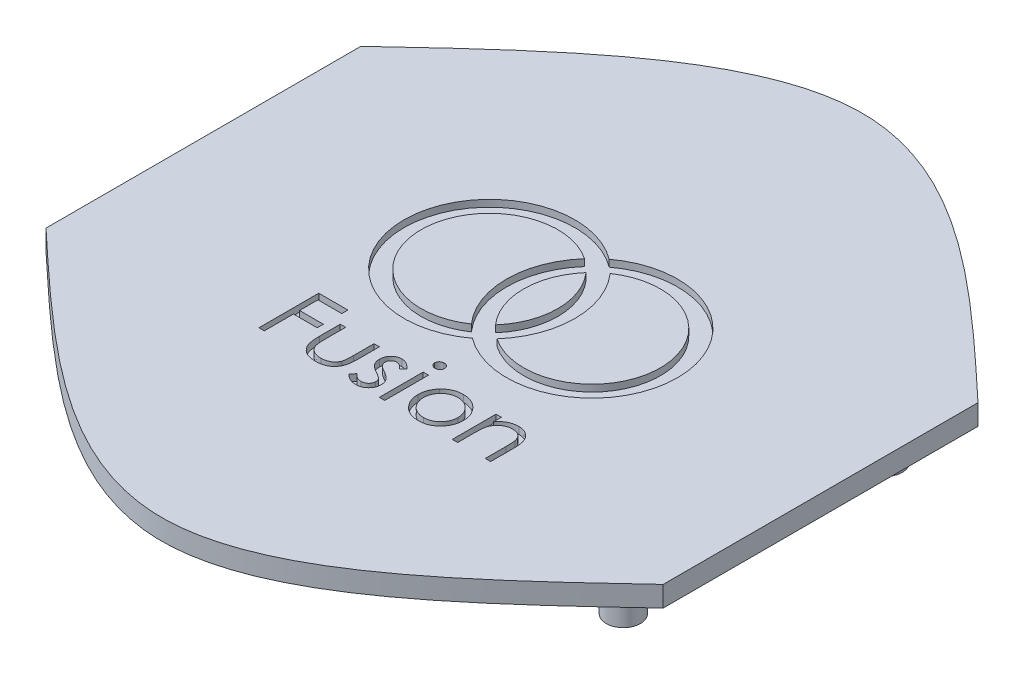
from build123d import *

# Parameters (mm, degrees)
BOSS_EXTRUDE1_DEPTH = 1.2
SKETCH3_R           = 1
BOSS_EXTRUDE2_DEPTH = 3
CUT_EXTRUDE1_DEPTH  = 0.4
SKETCH6_W           = 0.314102564
SKETCH6_H           = 2.557692308
CUT_EXTRUDE2_DEPTH  = 0.4


with BuildPart() as part:
    # Sketch1 → Boss-Extrude1 (new body)
    with BuildSketch(Plane(origin=(0, 0, 0), x_dir=(1, 0, 0), z_dir=(0, 1, 0))):
        with BuildLine():
            Line((0, 41.863275017), (0, 60.273275017))
            add(Edge.make_bspline(
                [(-36.089994589, 60.273275017), (-30.074992276, 65.911788101), (-18.044987203, 77.188479216), (-6.014995884, 65.911788385), (0, 60.273275017)],
                knots=[0, 0, 0, 0, 0.499999981, 1, 1, 1, 1], degree=3))
            Line((-36.089994589, 60.273275017), (-36.089994589, 41.863275017))
            add(Edge.make_bspline(
                [(-36.089994589, 41.863275017), (-30.074992276, 36.224761933), (-18.044987203, 24.948070818), (-6.014995884, 36.22476165), (0, 41.863275017)],
                knots=[0, 0, 0, 0, 0.499999981, 1, 1, 1, 1], degree=3))
        make_face()
    extrude(amount=BOSS_EXTRUDE1_DEPTH)

    # Sketch3 → Boss-Extrude2 (add)
    with BuildSketch(Plane.XZ):
        with Locations((-32.210609347, -58.722469159)):
            Circle(SKETCH3_R)
        with Locations((-32.210609347, -43.414080875)):
            Circle(SKETCH3_R)
        with Locations((-3.879385242, -43.414080875)):
            Circle(SKETCH3_R)
        with Locations((-3.879385242, -58.722469159)):
            Circle(SKETCH3_R)
    extrude(amount=BOSS_EXTRUDE2_DEPTH)

    # Sketch5 → Cut-Extrude1 (cut)
    with BuildSketch(Plane(origin=(0, 1.2, 0), x_dir=(1, 0, 0), z_dir=(0, 1, 0))):
        with BuildLine():
            ThreePointArc((-18.044997294, 56.751086287), (-26.044997294, 52.751086287), (-18.044997294, 48.751086287))
            ThreePointArc((-18.044997294, 48.751086287), (-10.044997294, 52.751086287), (-18.044997294, 56.751086287))
        make_face()
        with BuildLine():
            ThreePointArc((-18.044997294, 55.396837598), (-17.044997294, 52.751086287), (-18.044997294, 50.105334976))
            ThreePointArc((-18.044997294, 50.105334976), (-19.044997294, 52.751086287), (-18.044997294, 55.396837598))
        make_face(mode=Mode.SUBTRACT)
        with BuildLine():
            ThreePointArc((-17.294997294, 56.058275426), (-11.044997294, 52.751086287), (-17.294997294, 49.443897149))
            ThreePointArc((-17.294997294, 49.443897149), (-16.044997294, 52.751086287), (-17.294997294, 56.058275426))
        make_face(mode=Mode.SUBTRACT)
        with BuildLine():
            ThreePointArc((-18.794997294, 56.058275426), (-20.044997294, 52.751086287), (-18.794997294, 49.443897149))
            ThreePointArc((-18.794997294, 49.443897149), (-25.044997294, 52.751086287), (-18.794997294, 56.058275426))
        make_face(mode=Mode.SUBTRACT)
    extrude(amount=-CUT_EXTRUDE1_DEPTH, mode=Mode.SUBTRACT)

    # Sketch6 → Cut-Extrude2 (cut)
    # profile 1 of 7: a face of its own
    with BuildSketch(Plane(origin=(0, 1.2, 0), x_dir=(1, 0, 0), z_dir=(0, 1, 0))):
        Polygon((-24.817053319, 46.540134371), (-23.111925113, 46.540134371), (-23.111925113, 46.181160012), (-24.502950754, 46.181160012), (-24.502950754, 45.104236935), (-23.111925113, 45.104236935), (-23.111925113, 44.745262576), (-24.502950754, 44.745262576), (-24.502950754, 43.040134371), (-24.817053319, 43.040134371), align=None)
    # profile 2 of 7: a face of its own
    with BuildSketch(Plane(origin=(0, 1.2, 0), x_dir=(1, 0, 0), z_dir=(0, 1, 0))):
        with BuildLine():
            Line((-22.61833537, 45.597826679), (-22.304232806, 45.597826679))
            Line((-22.304232806, 45.597826679), (-22.304232806, 44.411528602))
            add(Edge.make_bspline(
                [(-22.304232806, 44.411528602), (-22.304090901, 44.376705853), (-22.303819443, 44.310091565), (-22.301978502, 44.214236378), (-22.297648409, 44.126819665), (-22.292234584, 44.047790928), (-22.285272448, 43.977163537), (-22.276989088, 43.91518418), (-22.267730666, 43.861149996), (-22.258667952, 43.82860664), (-22.254453158, 43.813471711)],
                knots=[0, 0, 0, 0, 1.388932606, 2.656963016, 3.823490214, 4.879454478, 5.816252168, 6.653371382, 7.373723809, 8, 8, 8, 8], degree=3))
            add(Edge.make_bspline(
                [(-22.254453158, 43.813471711), (-22.247691703, 43.79444884), (-22.234309362, 43.756798579), (-22.210035878, 43.702409574), (-22.180007542, 43.652034291), (-22.147147714, 43.603730218), (-22.109248306, 43.558928232), (-22.066788835, 43.517703988), (-22.021190598, 43.478499897), (-21.953435575, 43.432115105), (-21.860776309, 43.382399775), (-21.739123554, 43.339503956), (-21.607219328, 43.313868136), (-21.516054608, 43.310893881), (-21.469196748, 43.30936514)],
                knots=[0, 0, 0, 0, 0.725840625, 1.436591201, 2.137033971, 2.831655856, 3.53531722, 4.242432219, 4.957935707, 5.694543706, 7.190802206, 8.724350549, 10.316345118, 12, 12, 12, 12], degree=3))
            add(Edge.make_bspline(
                [(-21.469196748, 43.30936514), (-21.42234324, 43.310926389), (-21.331690372, 43.313947116), (-21.201235403, 43.338730655), (-21.081983988, 43.380136344), (-20.975133037, 43.437943755), (-20.881167197, 43.508685818), (-20.802862778, 43.591694627), (-20.738255523, 43.684344014), (-20.710046103, 43.753468293), (-20.695859408, 43.788231326)],
                knots=[0, 0, 0, 0, 1.157059328, 2.238695713, 3.266970494, 4.264342957, 5.228770407, 6.160125903, 7.074715775, 8, 8, 8, 8], degree=3))
            add(Edge.make_bspline(
                [(-20.695859408, 43.788231326), (-20.691665178, 43.802197625), (-20.68239276, 43.8330737), (-20.672430408, 43.885453449), (-20.663455947, 43.947918053), (-20.655792771, 44.020876262), (-20.650327608, 44.104137414), (-20.647381581, 44.19767549), (-20.644053306, 44.301196851), (-20.64400279, 44.37366461), (-20.643976395, 44.411528602)],
                knots=[0, 0, 0, 0, 0.557542046, 1.232589297, 2.036731608, 2.971723315, 4.038036528, 5.22795436, 6.551621927, 8, 8, 8, 8], degree=3))
            Line((-20.643976395, 44.411528602), (-20.643976395, 45.597826679))
            Line((-20.643976395, 45.597826679), (-20.329873831, 45.597826679))
            Line((-20.329873831, 45.597826679), (-20.329873831, 44.352634371))
            add(Edge.make_bspline(
                [(-20.329873831, 44.352634371), (-20.330315526, 44.3103272), (-20.331172475, 44.2282455), (-20.336679818, 44.108961388), (-20.346129431, 43.997799143), (-20.360472116, 43.894699923), (-20.37733779, 43.799742442), (-20.399094063, 43.712804996), (-20.425072301, 43.634155442), (-20.454377816, 43.562413665), (-20.488999683, 43.497366771), (-20.525826704, 43.435630954), (-20.568351476, 43.378738019), (-20.61312171, 43.323855882), (-20.662923366, 43.273714354), (-20.716823225, 43.227162878), (-20.774062645, 43.183489847), (-20.835911843, 43.144398567), (-20.901467906, 43.109181922), (-20.970811763, 43.077965844), (-21.044792761, 43.053263267), (-21.122456398, 43.031952601), (-21.204183177, 43.015238132), (-21.28989431, 43.003451565), (-21.379560927, 42.996226234), (-21.440670386, 42.995589189), (-21.472001235, 42.995262576)],
                knots=[0, 0, 0, 0, 1.493040784, 2.896703357, 4.213163133, 5.428574705, 6.569057535, 7.615249723, 8.588095153, 9.490268104, 10.346124644, 11.18633936, 12.024365274, 12.850166724, 13.684164916, 14.514361689, 15.362232829, 16.222528818, 17.093394965, 17.986930858, 18.902426812, 19.842810585, 20.827885679, 21.843828298, 22.894529745, 24, 24, 24, 24], degree=3))
            add(Edge.make_bspline(
                [(-21.472001235, 42.995262576), (-21.503097749, 42.995602283), (-21.564205294, 42.99626984), (-21.653876539, 43.003411647), (-21.739825145, 43.015219818), (-21.821745543, 43.032075035), (-21.899719941, 43.053114105), (-21.974064181, 43.078117641), (-22.043907744, 43.109198122), (-22.110089748, 43.14417568), (-22.172092136, 43.183740955), (-22.230200714, 43.227108995), (-22.284337566, 43.274215058), (-22.334514634, 43.324862415), (-22.380027611, 43.379679351), (-22.421443653, 43.438224912), (-22.459400358, 43.499919), (-22.493753148, 43.565982163), (-22.523264904, 43.638554173), (-22.54932015, 43.71885127), (-22.570630788, 43.807753787), (-22.587973256, 43.905185715), (-22.601924697, 44.010680757), (-22.611610839, 44.124849172), (-22.61702667, 44.247412864), (-22.617889731, 44.332062754), (-22.61833537, 44.37577139)],
                knots=[0, 0, 0, 0, 1.083640291, 2.129454052, 3.13281866, 4.105697902, 5.042300162, 5.946461698, 6.836384745, 7.703652036, 8.553297018, 9.397182691, 10.228592656, 11.052265423, 11.879314572, 12.708807002, 13.549817954, 14.402308542, 15.300838682, 16.27712199, 17.341985831, 18.484375296, 19.725102775, 21.0496083, 22.476576903, 24, 24, 24, 24], degree=3))
            Line((-22.61833537, 44.37577139), (-22.61833537, 45.597826679))
        make_face()
    # profile 3 of 7: a face of its own
    with BuildSketch(Plane(origin=(0, 1.2, 0), x_dir=(1, 0, 0), z_dir=(0, 1, 0))):
        with BuildLine():
            Line((-18.400386652, 45.278816262), (-18.613527677, 45.05936514))
            add(Edge.make_bspline(
                [(-18.613527677, 45.05936514), (-18.631918181, 45.080678287), (-18.667372907, 45.121767524), (-18.723604388, 45.17670459), (-18.779627991, 45.222841529), (-18.834676805, 45.261793788), (-18.890135074, 45.291242935), (-18.945351992, 45.312737797), (-19.000384731, 45.326039602), (-19.037170766, 45.327754041), (-19.055234408, 45.32859591)],
                knots=[0, 0, 0, 0, 1.26578478, 2.440284043, 3.530471711, 4.527705817, 5.468200915, 6.346673037, 7.188140097, 8, 8, 8, 8], degree=3))
            add(Edge.make_bspline(
                [(-19.055234408, 45.32859591), (-19.077373798, 45.327521037), (-19.120940984, 45.325405839), (-19.183366802, 45.304292408), (-19.241317427, 45.27188367), (-19.291474407, 45.225915086), (-19.333962087, 45.173150817), (-19.364975768, 45.114154493), (-19.383941752, 45.050706449), (-19.386346484, 45.006676591), (-19.387566139, 44.984345108)],
                knots=[0, 0, 0, 0, 0.99966794, 1.967205029, 2.953328237, 3.988086729, 5.028030931, 6.008226631, 6.989793394, 8, 8, 8, 8], degree=3))
            add(Edge.make_bspline(
                [(-19.387566139, 44.984345108), (-19.386455327, 44.964133064), (-19.384236834, 44.923765953), (-19.366990154, 44.864217919), (-19.339524082, 44.806160881), (-19.313853888, 44.770597975), (-19.300627036, 44.752273794)],
                knots=[0, 0, 0, 0, 0.960159726, 1.917612774, 2.927026955, 4, 4, 4, 4], degree=3))
            add(Edge.make_bspline(
                [(-19.300627036, 44.752273794), (-19.292663543, 44.74248921), (-19.27571425, 44.721663955), (-19.243905735, 44.692760102), (-19.207883232, 44.660817851), (-19.164563294, 44.628881014), (-19.115812266, 44.595249289), (-19.060572982, 44.561247156), (-19.000598477, 44.524282731), (-18.957661171, 44.500838295), (-18.935342581, 44.488651999)],
                knots=[0, 0, 0, 0, 0.66740084, 1.420478572, 2.27185888, 3.217733974, 4.268547843, 5.408967954, 6.65319498, 8, 8, 8, 8], degree=3))
            add(Edge.make_bspline(
                [(-18.935342581, 44.488651999), (-18.908129004, 44.473407096), (-18.855561334, 44.443958964), (-18.780868567, 44.398249261), (-18.713081526, 44.352817836), (-18.651625858, 44.308150562), (-18.597684049, 44.262997695), (-18.549619497, 44.219089938), (-18.508631053, 44.17510063), (-18.485677126, 44.144367516), (-18.474705562, 44.12967764)],
                knots=[0, 0, 0, 0, 1.27191281, 2.456916733, 3.569705269, 4.599008579, 5.553216877, 6.436649441, 7.252746552, 8, 8, 8, 8], degree=3))
            add(Edge.make_bspline(
                [(-18.474705562, 44.12967764), (-18.456495035, 44.100011552), (-18.420252705, 44.040970531), (-18.382194439, 43.943752104), (-18.360134164, 43.840641601), (-18.357071944, 43.770109381), (-18.355514857, 43.734244948)],
                knots=[0, 0, 0, 0, 0.995354457, 1.980940102, 2.973342415, 4, 4, 4, 4], degree=3))
            add(Edge.make_bspline(
                [(-18.355514857, 43.734244948), (-18.356234391, 43.708975802), (-18.357652311, 43.659180189), (-18.367510378, 43.585845359), (-18.384465354, 43.515710801), (-18.407559108, 43.448015517), (-18.438743481, 43.384056577), (-18.475291278, 43.322220328), (-18.51916619, 43.263844397), (-18.569257565, 43.209005437), (-18.624103059, 43.15891969), (-18.682609198, 43.114895736), (-18.744848028, 43.078321399), (-18.81037483, 43.048056053), (-18.879338484, 43.023987795), (-18.951749773, 43.007325264), (-19.027378528, 42.997352503), (-19.078808336, 42.995968027), (-19.105014056, 42.995262576)],
                knots=[0, 0, 0, 0, 1.032770009, 2.035186124, 3.017557409, 3.978232242, 4.952395191, 5.920591857, 6.910227898, 7.931268572, 8.952309245, 9.941945286, 10.918353717, 11.897095711, 12.887975737, 13.898235213, 14.929059601, 16, 16, 16, 16], degree=3))
            add(Edge.make_bspline(
                [(-19.105014056, 42.995262576), (-19.140381231, 42.996255277), (-19.210624158, 42.998226884), (-19.314513877, 43.016732945), (-19.416034636, 43.045528339), (-19.514418176, 43.085244273), (-19.60746429, 43.135394986), (-19.692595215, 43.195457379), (-19.770106677, 43.263447377), (-19.814224951, 43.315560288), (-19.836284088, 43.341616743)],
                knots=[0, 0, 0, 0, 1.013940152, 2.01379169, 3.017749504, 4.037548394, 5.051665909, 6.043208538, 7.021604269, 8, 8, 8, 8], degree=3))
            Line((-19.836284088, 43.341616743), (-19.628050915, 43.57859591))
            add(Edge.make_bspline(
                [(-19.628050915, 43.57859591), (-19.608278502, 43.557241145), (-19.569946689, 43.515841705), (-19.508645473, 43.460717364), (-19.446266072, 43.414516093), (-19.383431385, 43.375872678), (-19.319211291, 43.346097275), (-19.253965676, 43.325178681), (-19.187827252, 43.311734489), (-19.143405117, 43.310156207), (-19.121139857, 43.30936514)],
                knots=[0, 0, 0, 0, 1.179806542, 2.287233372, 3.337373186, 4.324005949, 5.273901747, 6.200048787, 7.097828587, 8, 8, 8, 8], degree=3))
            add(Edge.make_bspline(
                [(-19.121139857, 43.30936514), (-19.090821931, 43.310735965), (-19.031585789, 43.313414327), (-18.946742031, 43.337731419), (-18.868403404, 43.375861371), (-18.800380059, 43.429946069), (-18.742477898, 43.492901642), (-18.700549723, 43.563815761), (-18.674273548, 43.640607218), (-18.671187549, 43.69383952), (-18.669617421, 43.720923634)],
                knots=[0, 0, 0, 0, 1.072336372, 2.095165389, 3.102688358, 4.141489647, 5.156069229, 6.117746104, 7.042326257, 8, 8, 8, 8], degree=3))
            add(Edge.make_bspline(
                [(-18.669617421, 43.720923634), (-18.670703715, 43.743233253), (-18.672848458, 43.787280608), (-18.68969173, 43.851030949), (-18.716304582, 43.91150023), (-18.742509231, 43.946889877), (-18.755855402, 43.964914019)],
                knots=[0, 0, 0, 0, 1.013901739, 2.00181326, 2.98231254, 4, 4, 4, 4], degree=3))
            add(Edge.make_bspline(
                [(-18.755855402, 43.964914019), (-18.763877796, 43.973949381), (-18.781353469, 43.993631663), (-18.81340871, 44.022056742), (-18.851790572, 44.052694841), (-18.896930735, 44.08502643), (-18.948920197, 44.118625035), (-19.007969672, 44.153314387), (-19.073270225, 44.190742113), (-19.119440856, 44.215561768), (-19.143575754, 44.228535813)],
                knots=[0, 0, 0, 0, 0.615000592, 1.339693406, 2.178160186, 3.116406724, 4.166410947, 5.330106347, 6.604359322, 8, 8, 8, 8], degree=3))
            add(Edge.make_bspline(
                [(-19.143575754, 44.228535813), (-19.169622394, 44.243074945), (-19.220135142, 44.271270961), (-19.291682433, 44.315187042), (-19.356229787, 44.359854316), (-19.415330362, 44.402767156), (-19.467491367, 44.446188099), (-19.512507316, 44.490165351), (-19.552150531, 44.532925337), (-19.574097943, 44.563222634), (-19.584581363, 44.577694467)],
                knots=[0, 0, 0, 0, 1.262093308, 2.447601706, 3.550203992, 4.582594899, 5.537233252, 6.418365656, 7.244515135, 8, 8, 8, 8], degree=3))
            add(Edge.make_bspline(
                [(-19.584581363, 44.577694467), (-19.602711963, 44.606840082), (-19.638979498, 44.665141498), (-19.674194689, 44.762451974), (-19.698400718, 44.864897032), (-19.700563108, 44.935583886), (-19.701668703, 44.971724916)],
                knots=[0, 0, 0, 0, 0.985009483, 1.970363186, 2.962279964, 4, 4, 4, 4], degree=3))
            add(Edge.make_bspline(
                [(-19.701668703, 44.971724916), (-19.701134508, 44.995350314), (-19.700089012, 45.041588565), (-19.69174496, 45.109527385), (-19.676553249, 45.174075539), (-19.657498326, 45.236202402), (-19.631015322, 45.294704496), (-19.599369417, 45.350361967), (-19.562181992, 45.403097885), (-19.519338701, 45.452101017), (-19.472232056, 45.496610343), (-19.421337286, 45.535408971), (-19.36779903, 45.568515326), (-19.31139061, 45.596280487), (-19.251570137, 45.617281869), (-19.188755751, 45.631739255), (-19.123074596, 45.641394457), (-19.07817347, 45.642257542), (-19.055234408, 45.642698474)],
                knots=[0, 0, 0, 0, 1.087655834, 2.128696564, 3.144119009, 4.137814668, 5.115653402, 6.093965665, 7.082169637, 8.081268856, 9.086088321, 10.061021666, 11.022561449, 11.980240094, 12.950172527, 13.934149372, 14.944599409, 16, 16, 16, 16], degree=3))
            add(Edge.make_bspline(
                [(-19.055234408, 45.642698474), (-19.028042345, 45.641594133), (-18.973148123, 45.639364735), (-18.890793497, 45.621659045), (-18.808560155, 45.592525941), (-18.726236805, 45.552289707), (-18.644426515, 45.500222831), (-18.562409659, 45.437293532), (-18.479201629, 45.363915817), (-18.427245315, 45.307816592), (-18.400386652, 45.278816262)],
                knots=[0, 0, 0, 0, 0.845714091, 1.707292901, 2.609013841, 3.555613372, 4.552488639, 5.621697636, 6.770543573, 8, 8, 8, 8], degree=3))
        make_face()
    # profile 4 of 7: a face of its own
    with BuildSketch(Plane(origin=(0, 1.2, 0), x_dir=(1, 0, 0), z_dir=(0, 1, 0))):
        with BuildLine():
            add(Edge.make_bspline(
                [(-17.616532485, 46.674749756), (-17.597041169, 46.673845603), (-17.55887343, 46.672075099), (-17.503680162, 46.656913622), (-17.45342315, 46.631213937), (-17.408845417, 46.596734256), (-17.37059353, 46.556184812), (-17.34381282, 46.508923844), (-17.326600424, 46.457865205), (-17.324521868, 46.422250116), (-17.323463575, 46.404116743)],
                knots=[0, 0, 0, 0, 1.055194115, 2.066272739, 3.074728998, 4.095836921, 5.109056067, 6.073838105, 7.019297344, 8, 8, 8, 8], degree=3))
            add(Edge.make_bspline(
                [(-17.323463575, 46.404116743), (-17.324545735, 46.38645409), (-17.326685037, 46.351537115), (-17.343799525, 46.301363643), (-17.370821763, 46.254759359), (-17.408820888, 46.214288649), (-17.453429649, 46.179828029), (-17.503678435, 46.15412329), (-17.558873884, 46.138963153), (-17.597041323, 46.137192464), (-17.616532485, 46.136288217)],
                knots=[0, 0, 0, 0, 0.96129708, 1.900370562, 2.859976407, 3.87933698, 4.906634145, 5.921202961, 6.938410037, 8, 8, 8, 8], degree=3))
            add(Edge.make_bspline(
                [(-17.616532485, 46.136288217), (-17.63580076, 46.137157937), (-17.67330394, 46.138850734), (-17.727670783, 46.154420752), (-17.777499272, 46.179836825), (-17.822163945, 46.21406301), (-17.859394138, 46.255007907), (-17.886492463, 46.301335201), (-17.903567425, 46.351544356), (-17.905712054, 46.386456522), (-17.906796908, 46.404116743)],
                knots=[0, 0, 0, 0, 1.054934014, 2.053291228, 3.073705704, 4.106921865, 5.123545215, 6.088680038, 7.033164197, 8, 8, 8, 8], degree=3))
            add(Edge.make_bspline(
                [(-17.906796908, 46.404116743), (-17.905735822, 46.422247592), (-17.903651781, 46.457857725), (-17.886479664, 46.508952758), (-17.859619857, 46.55593426), (-17.822139293, 46.596959759), (-17.777505833, 46.631205194), (-17.727669088, 46.656616175), (-17.673304388, 46.672187515), (-17.635800912, 46.673880129), (-17.616532485, 46.674749756)],
                knots=[0, 0, 0, 0, 0.98631895, 1.937192651, 2.907499808, 3.917963147, 4.944918757, 5.95915025, 6.951458133, 8, 8, 8, 8], degree=3))
        make_face()
    # profile 5 of 7: a face of its own
    with BuildSketch(Plane(origin=(0, 1.2, 0), x_dir=(1, 0, 0), z_dir=(0, 1, 0))):
        with Locations((-17.615130242, 44.318980525)):
            Rectangle(SKETCH6_W, SKETCH6_H)
    # profile 6 of 7: a face of its own
    with BuildSketch(Plane(origin=(0, 1.2, 0), x_dir=(1, 0, 0), z_dir=(0, 1, 0))):
        with BuildLine():
            add(Edge.make_bspline(
                [(-15.459881844, 45.642698474), (-15.411890571, 45.641676582), (-15.317791414, 45.639672904), (-15.179983528, 45.618257938), (-15.048438392, 45.585510574), (-14.9226522, 45.540239012), (-14.804235904, 45.479557061), (-14.69146466, 45.40714777), (-14.584647651, 45.321365176), (-14.520624622, 45.255007108), (-14.488127036, 45.221324275)],
                knots=[0, 0, 0, 0, 1.054011418, 2.066658804, 3.057071809, 4.030435133, 4.997543892, 5.974964718, 6.972108034, 8, 8, 8, 8], degree=3))
            add(Edge.make_bspline(
                [(-14.488127036, 45.221324275), (-14.460145082, 45.189110289), (-14.404722702, 45.125305747), (-14.333656983, 45.021850134), (-14.272435423, 44.914710033), (-14.223372462, 44.802462707), (-14.184687439, 44.686088036), (-14.157221742, 44.565186024), (-14.140884807, 44.440023677), (-14.13868184, 44.355019839), (-14.137566139, 44.311969307)],
                knots=[0, 0, 0, 0, 1.025258237, 2.030674902, 3.01204498, 3.988269485, 4.97094183, 5.956517959, 6.965070386, 8, 8, 8, 8], degree=3))
            add(Edge.make_bspline(
                [(-14.137566139, 44.311969307), (-14.138547476, 44.268669249), (-14.140486645, 44.183106316), (-14.158830261, 44.05708695), (-14.187361347, 43.934892127), (-14.228193185, 43.817033434), (-14.280551294, 43.703150606), (-14.344441982, 43.593741057), (-14.420313599, 43.488588924), (-14.506317596, 43.388587086), (-14.601369472, 43.296420871), (-14.70448562, 43.216092601), (-14.813639654, 43.147271077), (-14.930283007, 43.091834661), (-15.053350494, 43.048124961), (-15.183107562, 43.017424944), (-15.319352633, 42.998863261), (-15.412379854, 42.996479687), (-15.459881844, 42.995262576)],
                knots=[0, 0, 0, 0, 0.998656419, 1.973391657, 2.932242238, 3.890759089, 4.846373663, 5.82037756, 6.809684879, 7.83454468, 8.860553229, 9.859544525, 10.845671541, 11.83227036, 12.833544569, 13.85385346, 14.904124723, 16, 16, 16, 16], degree=3))
            add(Edge.make_bspline(
                [(-15.459881844, 42.995262576), (-15.507616564, 42.996483772), (-15.601107423, 42.998875547), (-15.737833405, 43.01735283), (-15.867823024, 43.048110812), (-15.991051623, 43.091978305), (-16.10819647, 43.147272849), (-16.217982967, 43.215884538), (-16.321182882, 43.296444693), (-16.416254867, 43.388580631), (-16.502253472, 43.488590587), (-16.57812648, 43.593740625), (-16.642016806, 43.703150719), (-16.69437501, 43.817033404), (-16.735206823, 43.934892136), (-16.763737916, 44.057086948), (-16.78208153, 44.183106317), (-16.784020699, 44.268669249), (-16.785002036, 44.311969307)],
                knots=[0, 0, 0, 0, 1.099876186, 2.154163076, 3.173186993, 4.173200201, 5.163417411, 6.152872554, 7.150605724, 8.17532212, 9.198891216, 10.186952605, 11.159729845, 12.11414092, 13.071450619, 14.029093627, 15.002601286, 16, 16, 16, 16], degree=3))
            add(Edge.make_bspline(
                [(-16.785002036, 44.311969307), (-16.783878726, 44.354785853), (-16.781654765, 44.439555255), (-16.765334256, 44.564482316), (-16.737975699, 44.685179705), (-16.699244303, 44.801105181), (-16.649729112, 44.912860617), (-16.589367824, 45.020265448), (-16.517577191, 45.123253248), (-16.46237524, 45.186975329), (-16.434441139, 45.21922091)],
                knots=[0, 0, 0, 0, 1.031353054, 2.041901799, 3.029428768, 4.008703097, 4.981709435, 5.96992636, 6.972712378, 8, 8, 8, 8], degree=3))
            add(Edge.make_bspline(
                [(-16.434441139, 45.21922091), (-16.401992548, 45.253195849), (-16.338176684, 45.320013545), (-16.230827956, 45.405546069), (-16.118334135, 45.479462143), (-15.998609209, 45.538938358), (-15.872926351, 45.585776876), (-15.740707109, 45.618342391), (-15.602431593, 45.639595746), (-15.507871972, 45.641653924), (-15.459881844, 45.642698474)],
                knots=[0, 0, 0, 0, 1.027980169, 2.021703884, 2.998553061, 3.971491411, 4.943284454, 5.930300938, 6.949603206, 8, 8, 8, 8], degree=3))
        make_face()
        with BuildLine():
            add(Edge.make_bspline(
                [(-15.461284088, 45.32859591), (-15.495221699, 45.327631318), (-15.562220828, 45.325727035), (-15.660840412, 45.311243131), (-15.755780566, 45.288295627), (-15.84722141, 45.25569157), (-15.934854583, 45.213592671), (-16.018763985, 45.161884311), (-16.099196425, 45.101251355), (-16.174578489, 45.031788683), (-16.243760801, 44.955909689), (-16.304238777, 44.87506133), (-16.355663884, 44.790554983), (-16.398504043, 44.702302772), (-16.430411231, 44.609410358), (-16.453584253, 44.512929727), (-16.468054494, 44.412664311), (-16.469940872, 44.344503292), (-16.470899472, 44.309865942)],
                knots=[0, 0, 0, 0, 1.021534396, 2.016698045, 2.994645724, 3.958388632, 4.93408049, 5.916473867, 6.921342795, 7.962252576, 8.998418191, 10.008913653, 10.997312074, 11.973003931, 12.956656626, 13.948281152, 14.957379055, 16, 16, 16, 16], degree=3))
            add(Edge.make_bspline(
                [(-16.470899472, 44.309865942), (-16.469292649, 44.265113914), (-16.466103404, 44.176289509), (-16.440168168, 44.045478386), (-16.396781888, 43.919896534), (-16.338194608, 43.800280148), (-16.26478839, 43.68960787), (-16.178301323, 43.590936386), (-16.079661623, 43.505750574), (-15.970045122, 43.435069729), (-15.851690804, 43.378909973), (-15.726434483, 43.339110997), (-15.595793789, 43.313239305), (-15.506513058, 43.310667831), (-15.461284088, 43.30936514)],
                knots=[0, 0, 0, 0, 1.016792936, 2.018143844, 3.017858371, 4.030088057, 5.03801393, 6.028138512, 7.003788237, 7.991172063, 8.984598303, 9.972568034, 10.972917682, 12, 12, 12, 12], degree=3))
            add(Edge.make_bspline(
                [(-15.461284088, 43.30936514), (-15.416057719, 43.310675421), (-15.326782123, 43.313261877), (-15.196322946, 43.338980697), (-15.071408974, 43.379084358), (-14.953177587, 43.435006568), (-14.843610983, 43.506018982), (-14.744261862, 43.59045536), (-14.658513251, 43.689869211), (-14.585179646, 43.80042674), (-14.525632903, 43.919711092), (-14.482449701, 44.045501564), (-14.456452115, 44.176283606), (-14.453271287, 44.265111937), (-14.451668703, 44.309865942)],
                knots=[0, 0, 0, 0, 1.02726834, 2.027799167, 3.010890988, 4.004497153, 4.992059811, 5.971914811, 6.958719428, 7.966827853, 8.981595046, 9.981490638, 10.983022906, 12, 12, 12, 12], degree=3))
            add(Edge.make_bspline(
                [(-14.451668703, 44.309865942), (-14.452626973, 44.344503499), (-14.454512702, 44.412664925), (-14.468987667, 44.512927379), (-14.492143206, 44.609418975), (-14.524114824, 44.702270978), (-14.566768837, 44.790783483), (-14.61918563, 44.87481321), (-14.679416656, 44.956189756), (-14.749433777, 45.031543397), (-14.824737155, 45.101278433), (-14.905202193, 45.161907823), (-14.988987171, 45.213365418), (-15.076365754, 45.256051659), (-15.167818322, 45.287998999), (-15.262625451, 45.311375631), (-15.360824261, 45.325665827), (-15.427583304, 45.327612969), (-15.461284088, 45.32859591)],
                knots=[0, 0, 0, 0, 1.042956736, 2.052379634, 3.044323526, 4.02829302, 5.004299113, 5.996692471, 7.007513377, 8.048758398, 9.090003419, 10.095195979, 11.07790575, 12.047570684, 13.018257071, 13.989683339, 14.985167495, 16, 16, 16, 16], degree=3))
        make_face(mode=Mode.SUBTRACT)
    # profile 7 of 7: a face of its own
    with BuildSketch(Plane(origin=(0, 1.2, 0), x_dir=(1, 0, 0), z_dir=(0, 1, 0))):
        with BuildLine():
            Line((-13.509361011, 45.597826679), (-13.195258447, 45.597826679))
            Line((-13.195258447, 45.597826679), (-13.195258447, 45.136488538))
            add(Edge.make_bspline(
                [(-13.195258447, 45.136488538), (-13.161720812, 45.178331261), (-13.096639861, 45.259528524), (-12.988255527, 45.366249099), (-12.873711627, 45.454194324), (-12.753709623, 45.524298118), (-12.628086613, 45.577144744), (-12.497608343, 45.615310675), (-12.361493637, 45.638195503), (-12.2689292, 45.641185734), (-12.222101395, 45.642698474)],
                knots=[0, 0, 0, 0, 1.12780773, 2.188550248, 3.19190651, 4.159438251, 5.104880172, 6.052711206, 7.014878035, 8, 8, 8, 8], degree=3))
            add(Edge.make_bspline(
                [(-12.222101395, 45.642698474), (-12.174770761, 45.640953278), (-12.082133294, 45.63753751), (-11.947255232, 45.610520819), (-11.821281838, 45.564375564), (-11.704662283, 45.501163493), (-11.599535069, 45.42255702), (-11.507210218, 45.330979238), (-11.43084697, 45.225643155), (-11.379649607, 45.127919998), (-11.34592396, 45.041231204), (-11.324691622, 44.966984454), (-11.306660641, 44.884266303), (-11.291028893, 44.793326714), (-11.280451781, 44.693528524), (-11.272109489, 44.585280832), (-11.266130795, 44.468618701), (-11.265893588, 44.387932074), (-11.265771267, 44.346324275)],
                knots=[0, 0, 0, 0, 1.235846778, 2.418850247, 3.575807741, 4.728682307, 5.871620074, 6.994088408, 8.11269785, 9.256955736, 9.865816715, 10.540099792, 11.271859618, 12.076849838, 12.949306005, 13.892391288, 14.913166135, 16, 16, 16, 16], degree=3))
            Line((-11.265771267, 44.346324275), (-11.265771267, 43.040134371))
            Line((-11.265771267, 43.040134371), (-11.579873831, 43.040134371))
            Line((-11.579873831, 43.040134371), (-11.579873831, 44.243259371))
            add(Edge.make_bspline(
                [(-11.579873831, 44.243259371), (-11.580067039, 44.278081816), (-11.580436613, 44.344691227), (-11.58160226, 44.44006025), (-11.584412067, 44.526546828), (-11.58836038, 44.603944196), (-11.59413941, 44.672178032), (-11.600162041, 44.731387309), (-11.607527018, 44.781496852), (-11.614089931, 44.811661934), (-11.617033286, 44.825190461)],
                knots=[0, 0, 0, 0, 1.430800155, 2.736877192, 3.918605307, 4.986035426, 5.920637409, 6.731861385, 7.431261377, 8, 8, 8, 8], degree=3))
            add(Edge.make_bspline(
                [(-11.617033286, 44.825190461), (-11.627658818, 44.864901646), (-11.648109679, 44.94133339), (-11.698643662, 45.045007743), (-11.762457843, 45.133205931), (-11.840355692, 45.205382652), (-11.931584768, 45.261553489), (-12.03589191, 45.300527444), (-12.152270551, 45.324903713), (-12.234124934, 45.327330845), (-12.276788895, 45.32859591)],
                knots=[0, 0, 0, 0, 1.084156227, 2.086665306, 3.027808233, 3.945421172, 4.874247719, 5.839848303, 6.874090471, 8, 8, 8, 8], degree=3))
            add(Edge.make_bspline(
                [(-12.276788895, 45.32859591), (-12.302056579, 45.328119905), (-12.352060672, 45.327177904), (-12.426210644, 45.317726606), (-12.498134817, 45.30226815), (-12.568555026, 45.281399513), (-12.63606282, 45.252737244), (-12.702827111, 45.220207873), (-12.766333875, 45.179659661), (-12.827937272, 45.13446904), (-12.88525008, 45.084389833), (-12.938578418, 45.031545323), (-12.986116439, 44.975269719), (-13.029185114, 44.916469771), (-13.066363377, 44.854337933), (-13.098816465, 44.789473627), (-13.12635216, 44.721791478), (-13.140034853, 44.674816417), (-13.146881043, 44.651312256)],
                knots=[0, 0, 0, 0, 1.023777757, 2.026029729, 3.023749952, 4.003683103, 4.997618607, 5.993177895, 7.010360494, 8.046726602, 9.087585522, 10.09234134, 11.086953743, 12.070360549, 13.043493632, 14.017870808, 15.008233677, 16, 16, 16, 16], degree=3))
            add(Edge.make_bspline(
                [(-13.146881043, 44.651312256), (-13.150820691, 44.634057053), (-13.1593971, 44.596493378), (-13.16866028, 44.534848959), (-13.177067856, 44.463538984), (-13.184104814, 44.382646667), (-13.188410231, 44.291888792), (-13.193104627, 44.191652954), (-13.194813688, 44.081539466), (-13.195106043, 44.004877773), (-13.195258447, 43.964914019)],
                knots=[0, 0, 0, 0, 0.615963638, 1.340920617, 2.168419149, 3.115676021, 4.16674242, 5.331190069, 6.6087489, 8, 8, 8, 8], degree=3))
            Line((-13.195258447, 43.964914019), (-13.195258447, 43.040134371))
            Line((-13.195258447, 43.040134371), (-13.509361011, 43.040134371))
            Line((-13.509361011, 43.040134371), (-13.509361011, 45.597826679))
        make_face()
    extrude(amount=-CUT_EXTRUDE2_DEPTH, mode=Mode.SUBTRACT)


solid = part.part
